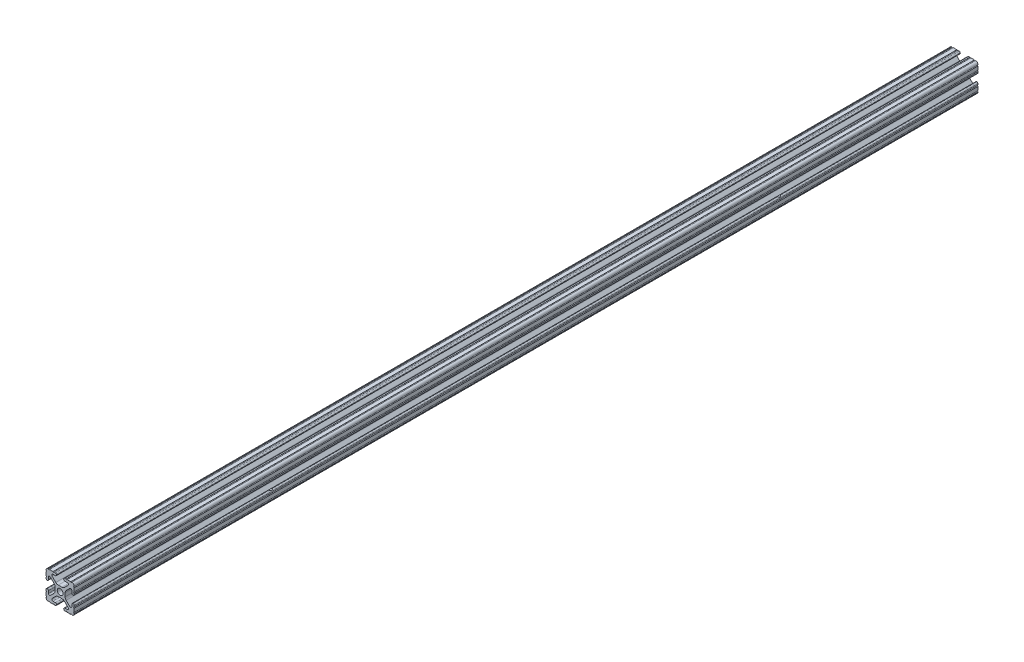
from build123d import *

# Parameters (mm, degrees)
SKETCH1_R               = 2.6035
BOSS_EXTRUDE1_DEPTH     = 406.4
CUT_EXTRUDE1_DEPTH      = 407.961847767
CUT_EXTRUDE1_DEPTH_BACK = 407.961847767
SKETCH2_R               = 3.175
CUT_EXTRUDE2_DEPTH      = 407.962384694
CUT_EXTRUDE2_DEPTH_BACK = 407.962384694
SKETCH3_R               = 3.5


with BuildPart() as part:
    # Sketch1 → Boss-Extrude1 (new, symmetric)
    with BuildSketch(Plane.XY):
        with BuildLine():
            Line((-7.179650497, -8.645192506), (-3.952270251, -5.423690499))
            ThreePointArc((-3.952270251, -5.423690499), (-2.922936451, -4.736929036), (-1.709253557, -4.4958))
            Line((-1.709253557, -4.4958), (1.709253557, -4.4958))
            ThreePointArc((1.709253557, -4.4958), (2.922936451, -4.736929036), (3.952270251, -5.423690499))
            Line((3.952270251, -5.423690499), (7.179650497, -8.645192506))
            ThreePointArc((7.179650497, -8.645192506), (7.41473083, -9.822813117), (6.416408329, -10.4902))
            Line((6.416408329, -10.4902), (4.287512407, -10.4902))
            ThreePointArc((4.287512407, -10.4902), (3.54574862, -10.79744862), (3.2385, -11.539212407))
            Line((3.2385, -11.539212407), (3.2385, -11.650987593))
            ThreePointArc((3.2385, -11.650987593), (3.54574862, -12.39275138), (4.287512407, -12.7))
            Line((4.287512407, -12.7), (5.317126718, -12.7))
            ThreePointArc((5.317126718, -12.7), (5.825126718, -12.192), (6.333126718, -12.7))
            Line((6.333126718, -12.7), (9.550443118, -12.7))
            ThreePointArc((9.550443118, -12.7), (10.058366869, -12.192000006), (10.566443095, -12.699847501))
            ThreePointArc((10.566443095, -12.699847501), (12.082537762, -12.08250727), (12.699846982, -10.566399977))
            ThreePointArc((12.699846982, -10.566399977), (12.192000006, -10.058323491), (12.7, -9.5504))
            Line((12.7, -9.5504), (12.7, -6.3330836))
            ThreePointArc((12.7, -6.3330836), (12.192, -5.8250836), (12.7, -5.3170836))
            Line((12.7, -5.3170836), (12.7, -4.287469289))
            ThreePointArc((12.7, -4.287469289), (12.39275138, -3.545705502), (11.650987593, -3.238456882))
            Line((11.650987593, -3.238456882), (11.539212407, -3.238456882))
            ThreePointArc((11.539212407, -3.238456882), (10.79744862, -3.545705502), (10.4902, -4.287469289))
            Line((10.4902, -4.287469289), (10.4902, -6.402089023))
            ThreePointArc((10.4902, -6.402089023), (9.856505071, -7.351067942), (8.737131347, -7.129408934))
            Line((8.737131347, -7.129408934), (5.441005833, -3.840816462))
            ThreePointArc((5.441005833, -3.840816462), (4.750877967, -2.809883091), (4.5085, -1.593185507))
            Line((4.5085, -1.593185507), (4.5085, 1.593185507))
            ThreePointArc((4.5085, 1.593185507), (4.750877967, 2.809883091), (5.441005833, 3.840816462))
            Line((5.441005833, 3.840816462), (8.737131347, 7.129408934))
            ThreePointArc((8.737131347, 7.129408934), (9.856505071, 7.351067942), (10.4902, 6.402089023))
            Line((10.4902, 6.402089023), (10.4902, 4.287469289))
            ThreePointArc((10.4902, 4.287469289), (10.79744862, 3.545705502), (11.539212407, 3.238456882))
            Line((11.539212407, 3.238456882), (11.650987593, 3.238456882))
            ThreePointArc((11.650987593, 3.238456882), (12.39275138, 3.545705502), (12.7, 4.287469289))
            Line((12.7, 4.287469289), (12.7, 5.3170836))
            ThreePointArc((12.7, 5.3170836), (12.192, 5.8250836), (12.7, 6.3330836))
            Line((12.7, 6.3330836), (12.7, 9.5504))
            ThreePointArc((12.7, 9.5504), (12.192000006, 10.058323491), (12.699846982, 10.566399977))
            ThreePointArc((12.699846982, 10.566399977), (12.082537762, 12.08250727), (10.566443095, 12.699847501))
            ThreePointArc((10.566443095, 12.699847501), (10.058366869, 12.192000006), (9.550443118, 12.7))
            Line((9.550443118, 12.7), (6.333126718, 12.7))
            ThreePointArc((6.333126718, 12.7), (5.825126718, 12.192), (5.317126718, 12.7))
            Line((5.317126718, 12.7), (4.287512407, 12.7))
            ThreePointArc((4.287512407, 12.7), (3.54574862, 12.39275138), (3.2385, 11.650987593))
            Line((3.2385, 11.650987593), (3.2385, 11.539212407))
            ThreePointArc((3.2385, 11.539212407), (3.54574862, 10.79744862), (4.287512407, 10.4902))
            Line((4.287512407, 10.4902), (6.476788598, 10.4902))
            ThreePointArc((6.476788598, 10.4902), (7.432222385, 9.85140422), (7.207036008, 8.724370562))
            Line((7.207036008, 8.724370562), (3.898272566, 5.423169045))
            ThreePointArc((3.898272566, 5.423169045), (2.869120213, 4.736787962), (1.655778399, 4.4958))
            Line((1.655778399, 4.4958), (-1.655778399, 4.4958))
            ThreePointArc((-1.655778399, 4.4958), (-2.869120213, 4.736787962), (-3.898272566, 5.423169045))
            Line((-3.898272566, 5.423169045), (-7.207036008, 8.724370562))
            ThreePointArc((-7.207036008, 8.724370562), (-7.432222385, 9.85140422), (-6.476788598, 10.4902))
            Line((-6.476788598, 10.4902), (-4.287512407, 10.4902))
            ThreePointArc((-4.287512407, 10.4902), (-3.54574862, 10.79744862), (-3.2385, 11.539212407))
            Line((-3.2385, 11.539212407), (-3.2385, 11.650987593))
            ThreePointArc((-3.2385, 11.650987593), (-3.54574862, 12.39275138), (-4.287512407, 12.7))
            Line((-4.287512407, 12.7), (-5.317126718, 12.7))
            ThreePointArc((-5.317126718, 12.7), (-5.825126718, 12.192), (-6.333126718, 12.7))
            Line((-6.333126718, 12.7), (-9.550443118, 12.7))
            ThreePointArc((-9.550443118, 12.7), (-10.058366869, 12.192000006), (-10.566443095, 12.699847501))
            ThreePointArc((-10.566443095, 12.699847501), (-12.082537762, 12.08250727), (-12.699846982, 10.566399977))
            ThreePointArc((-12.699846982, 10.566399977), (-12.192000006, 10.058323491), (-12.7, 9.5504))
            Line((-12.7, 9.5504), (-12.7, 6.3330836))
            ThreePointArc((-12.7, 6.3330836), (-12.192, 5.8250836), (-12.7, 5.3170836))
            Line((-12.7, 5.3170836), (-12.7, 4.287469289))
            ThreePointArc((-12.7, 4.287469289), (-12.39275138, 3.545705502), (-11.650987593, 3.238456882))
            Line((-11.650987593, 3.238456882), (-11.539212407, 3.238456882))
            ThreePointArc((-11.539212407, 3.238456882), (-10.79744862, 3.545705502), (-10.4902, 4.287469289))
            Line((-10.4902, 4.287469289), (-10.4902, 6.402089023))
            ThreePointArc((-10.4902, 6.402089023), (-9.856505071, 7.351067942), (-8.737131347, 7.129408934))
            Line((-8.737131347, 7.129408934), (-5.441005833, 3.840816462))
            ThreePointArc((-5.441005833, 3.840816462), (-4.750877967, 2.809883091), (-4.5085, 1.593185507))
            Line((-4.5085, 1.593185507), (-4.5085, -1.593185507))
            ThreePointArc((-4.5085, -1.593185507), (-4.750877967, -2.809883091), (-5.441005833, -3.840816462))
            Line((-5.441005833, -3.840816462), (-8.737131347, -7.129408934))
            ThreePointArc((-8.737131347, -7.129408934), (-9.856505071, -7.351067942), (-10.4902, -6.402089023))
            Line((-10.4902, -6.402089023), (-10.4902, -4.287469289))
            ThreePointArc((-10.4902, -4.287469289), (-10.79744862, -3.545705502), (-11.539212407, -3.238456882))
            Line((-11.539212407, -3.238456882), (-11.650987593, -3.238456882))
            ThreePointArc((-11.650987593, -3.238456882), (-12.39275138, -3.545705502), (-12.7, -4.287469289))
            Line((-12.7, -4.287469289), (-12.7, -5.3170836))
            ThreePointArc((-12.7, -5.3170836), (-12.192, -5.8250836), (-12.7, -6.3330836))
            Line((-12.7, -6.3330836), (-12.7, -9.5504))
            ThreePointArc((-12.7, -9.5504), (-12.192000006, -10.058323491), (-12.699846982, -10.566399977))
            ThreePointArc((-12.699846982, -10.566399977), (-12.082537762, -12.08250727), (-10.566443095, -12.699847501))
            ThreePointArc((-10.566443095, -12.699847501), (-10.058366869, -12.192000006), (-9.550443118, -12.7))
            Line((-9.550443118, -12.7), (-6.333126718, -12.7))
            ThreePointArc((-6.333126718, -12.7), (-5.825126718, -12.192), (-5.317126718, -12.7))
            Line((-5.317126718, -12.7), (-4.287512407, -12.7))
            ThreePointArc((-4.287512407, -12.7), (-3.54574862, -12.39275138), (-3.2385, -11.650987593))
            Line((-3.2385, -11.650987593), (-3.2385, -11.539212407))
            ThreePointArc((-3.2385, -11.539212407), (-3.54574862, -10.79744862), (-4.287512407, -10.4902))
            Line((-4.287512407, -10.4902), (-6.416408329, -10.4902))
            ThreePointArc((-6.416408329, -10.4902), (-7.41473083, -9.822813117), (-7.179650497, -8.645192506))
        make_face()
        Circle(SKETCH1_R, mode=Mode.SUBTRACT)
    extrude(amount=BOSS_EXTRUDE1_DEPTH, both=True)

    # Sketch2 → Cut-Extrude1 (cut, two sides: drawn at the far end of the back side and taken through both)
    with BuildSketch(Plane(origin=(0, 4.4958, 0), x_dir=(1, 0, 0), z_dir=(0, 1, 0)).offset(-CUT_EXTRUDE1_DEPTH_BACK)):
        with Locations((0.240663446, 250)):
            Circle(SKETCH2_R)
        with Locations((0, -250)):
            Circle(SKETCH2_R)
    extrude(amount=CUT_EXTRUDE1_DEPTH + CUT_EXTRUDE1_DEPTH_BACK, mode=Mode.SUBTRACT)

    # Sketch3 → Cut-Extrude2 (cut, two sides: drawn at the far end of the back side and taken through both)
    with BuildSketch(Plane(origin=(4.5085, 0, 0), x_dir=(0, 0, -1), z_dir=(1, 0, 0)).offset(-CUT_EXTRUDE2_DEPTH_BACK)):
        with Locations((228.53, 0)):
            Circle(SKETCH3_R)
        with Locations((-228.53, 0)):
            Circle(SKETCH3_R)
    extrude(amount=CUT_EXTRUDE2_DEPTH + CUT_EXTRUDE2_DEPTH_BACK, mode=Mode.SUBTRACT)


solid = part.part
